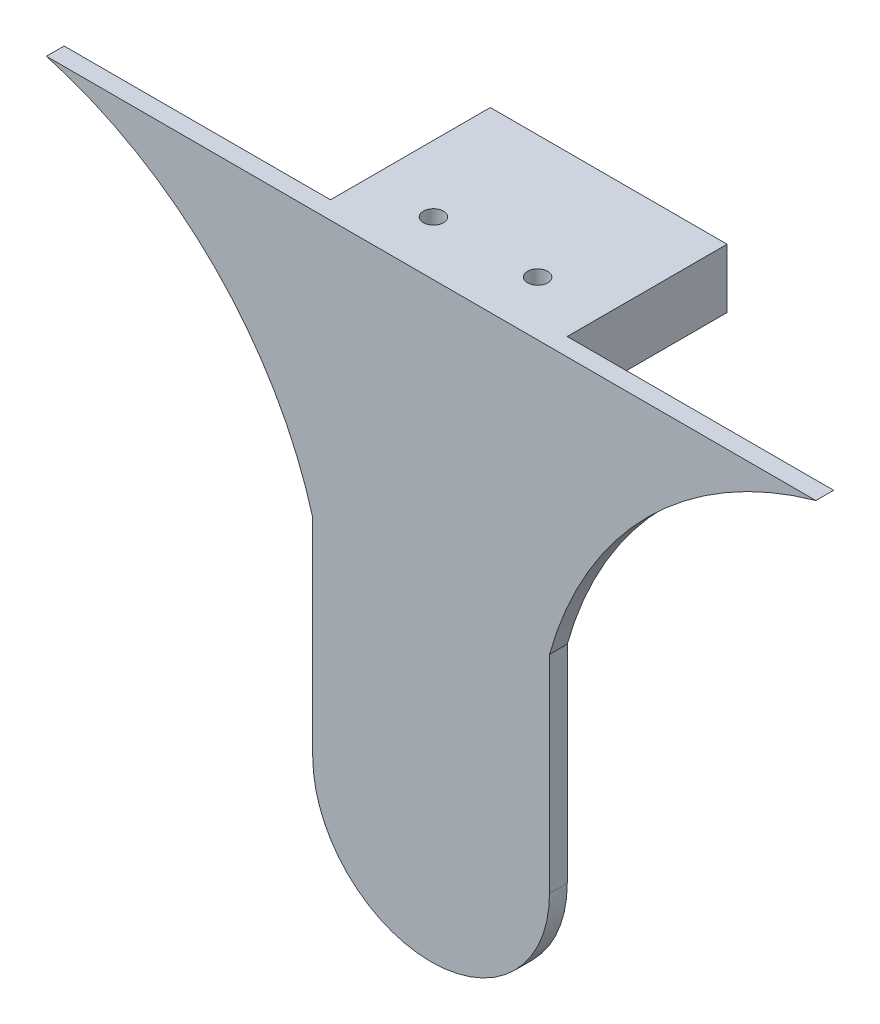
from build123d import *

# Parameters (mm, degrees)
SKETCH1_W            = 40
SKETCH1_H            = 100
BOSS_EXTRUDE1_DEPTH  = 3
FILLET1_R            = 20
SKETCH2_W            = 40
SKETCH2_H            = 10
BOSS_EXTRUDE2_DEPTH  = 27
M3_CLEARANCE_HOLE1_D = 3.4
BOSS_EXTRUDE4_DEPTH  = 3


with BuildPart() as part:
    # Sketch1 → Boss-Extrude1 (new body)
    with BuildSketch(Plane.XY):
        with Locations((20, 24.444444444)):
            Rectangle(SKETCH1_W, SKETCH1_H)
    extrude(amount=BOSS_EXTRUDE1_DEPTH)

    # Fillet1
    fillet1_edges = [part.edges().sort_by_distance(p)[0] for p in [
        (40, -25.555555556, 1.5),
        (0, -25.555555556, 1.5),
    ]]
    fillet(fillet1_edges, radius=FILLET1_R - 0.0001)  # a hair under: the kernel refuses the full size

    # Sketch2 → Boss-Extrude2 (add)
    with BuildSketch(Plane(origin=(0, 0, 0), x_dir=(-1, 0, 0), z_dir=(0, 0, -1))):
        with Locations((-20, 69.444444444)):
            Rectangle(SKETCH2_W, SKETCH2_H)
    extrude(amount=BOSS_EXTRUDE2_DEPTH)

    # M3 Clearance Hole1 (through all)
    with Locations(Plane(origin=(0, 64.444444444, 0), x_dir=(-1, 0, 0), z_dir=(0, -1, 0))):
        with Locations((-28.8, 6.190883488), (-11.2, 6.190883488)):
            Hole(M3_CLEARANCE_HOLE1_D / 2)

    # Sketch15 → Boss-Extrude4 (add)
    with BuildSketch(Plane.XY.offset(3)):
        with BuildLine():
            Line((85, 74.444444444), (40, 74.444444444))
            Line((40, 74.444444444), (40, 29.444444444))
            ThreePointArc((40, 29.444444444), (56.606100623, 57.838343821), (85, 74.444444444))
        make_face()
        with BuildLine():
            Line((0, 29.444444444), (0, 74.444444444))
            Line((0, 74.444444444), (-45, 74.444444444))
            ThreePointArc((-45, 74.444444444), (-16.606100623, 57.838343821), (0, 29.444444444))
        make_face()
    extrude(amount=-BOSS_EXTRUDE4_DEPTH)


solid = part.part
